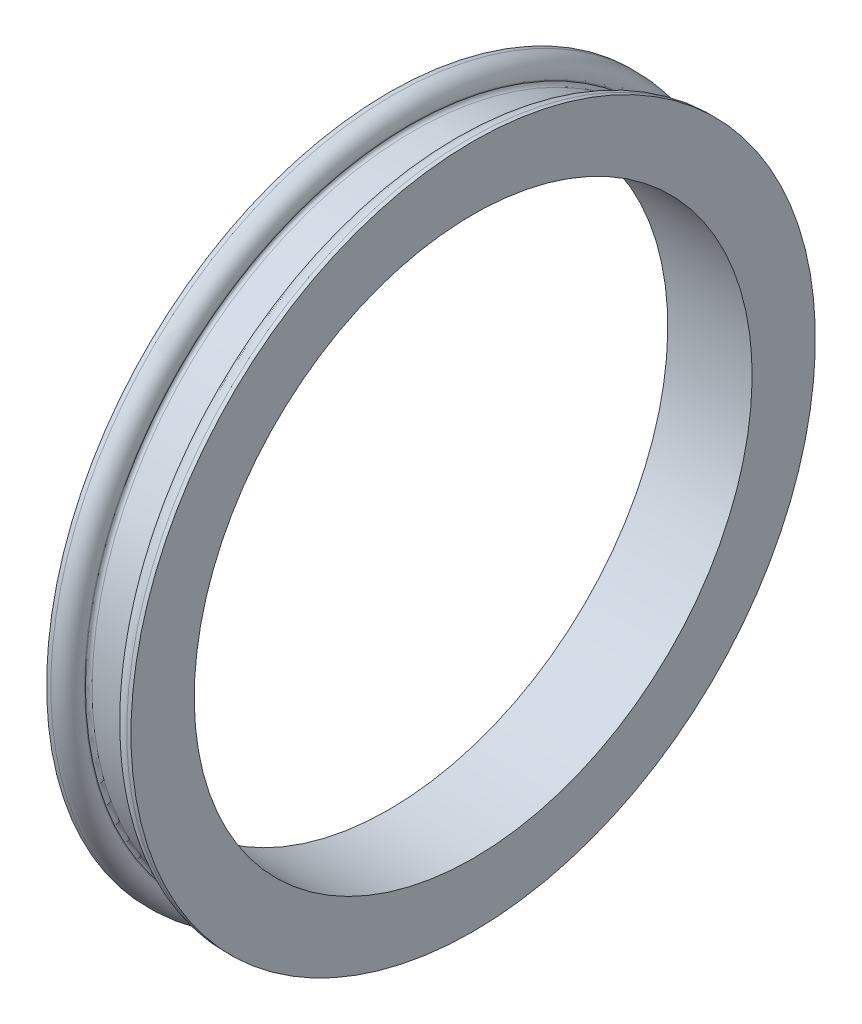
from build123d import *


with BuildPart() as part:
    # Sketch1 → Revolve1 (revolve)
    with BuildSketch(Plane.XY):
        with BuildLine():
            Line((-3.175, 21), (3.175, 21))
            Line((3.175, 21), (3.175, 25.7625))
            Line((3.175, 25.7625), (2.8575, 25.7625))
            ThreePointArc((2.8575, 25.7625), (1.959474388, 25.390525612), (1.5875, 24.4925))
            Line((1.5875, 24.4925), (1.5875, 24.429))
            ThreePointArc((1.5875, 24.429), (1.513105122, 24.249394878), (1.3335, 24.175))
            Line((1.3335, 24.175), (-1.3335, 24.175))
            ThreePointArc((-1.3335, 24.175), (-1.513105122, 24.249394878), (-1.5875, 24.429))
            Line((-1.5875, 24.429), (-1.5875, 24.4925))
            ThreePointArc((-1.5875, 24.4925), (-1.959474388, 25.390525612), (-2.8575, 25.7625))
            Line((-2.8575, 25.7625), (-3.175, 25.7625))
            Line((-3.175, 25.7625), (-3.175, 21))
        make_face()
    revolve(axis=Axis((-11.227577628, 0, 0), (1, 0, 0)))


solid = part.part
